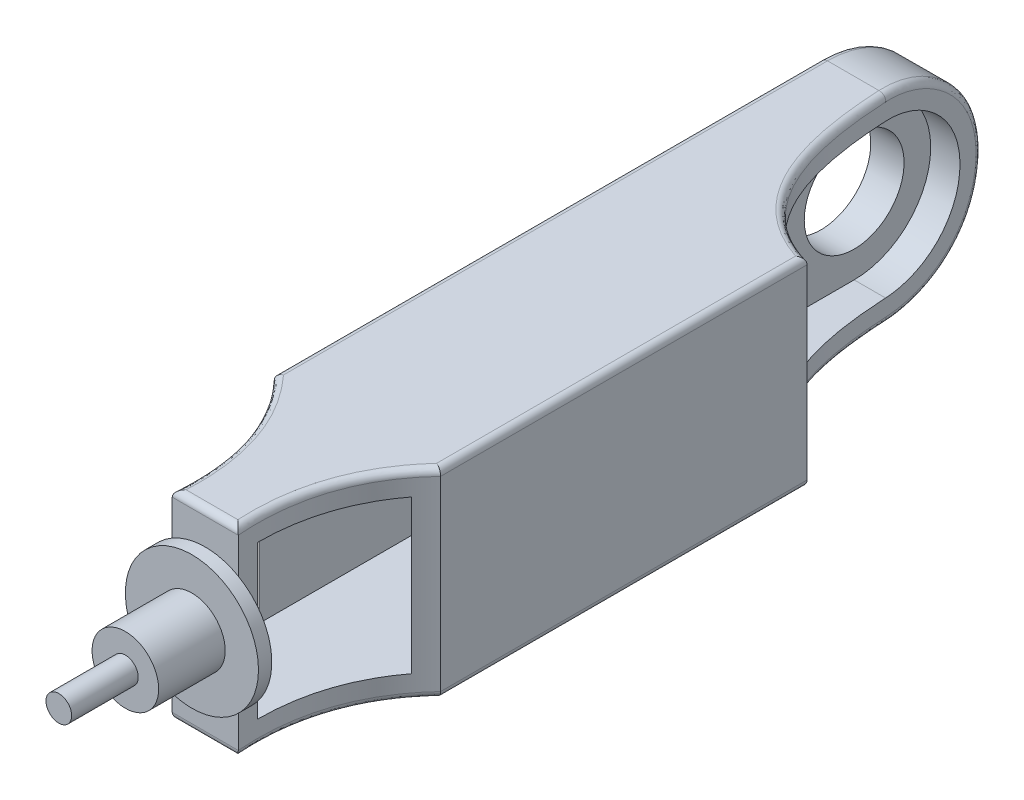
from build123d import *

# Parameters (mm, degrees)
SKETCH1_W           = 25
SKETCH1_H           = 30
BOSS_EXTRUDE1_DEPTH = 120
CUT_EXTRUDE1_REACH  = 125.491
CUT_EXTRUDE2_REACH  = 126.323
CUT_EXTRUDE3_DEPTH  = 20
CUT_EXTRUDE4_REACH  = 123.578
SKETCH5_W           = 18
SKETCH5_H           = 23
CUT_EXTRUDE5_REACH  = 125.491
SKETCH8_R           = 7.5
SKETCH10_W          = 25
SKETCH10_H          = 30
BOSS_EXTRUDE2_DEPTH = 3
SKETCH11_R          = 10
BOSS_EXTRUDE3_DEPTH = 2
SKETCH12_R          = 5
BOSS_EXTRUDE4_DEPTH = 10
SKETCH13_R          = 1.92997192
BOSS_EXTRUDE5_DEPTH = 10
CUT_EXTRUDE6_REACH  = 147.672
FILLET3_R           = 1


with BuildPart() as part:
    # Sketch1 → Boss-Extrude1 (new body)
    with BuildSketch(Plane.XY):
        Rectangle(SKETCH1_W, SKETCH1_H)
    extrude(amount=BOSS_EXTRUDE1_DEPTH)

    # Sketch2 → Cut-Extrude1 (cut, up to next)
    with BuildSketch(Plane(origin=(12.5, 0, 0), x_dir=(0, 0, -1), z_dir=(1, 0, 0)), mode=Mode.PRIVATE) as cut_extrude1_sk1:
        with BuildLine():
            ThreePointArc((0, 0), (-4.393398282, -10.606601718), (-15, -15))
            Line((-15, -15), (0, -15))
            Line((0, -15), (0, 0))
        make_face()
    cut_extrude1_tool1 = extrude(cut_extrude1_sk1.sketch, amount=-CUT_EXTRUDE1_REACH, mode=Mode.PRIVATE) & part.part
    # Sketch2 → Cut-Extrude1 (cut, up to next)
    with BuildSketch(Plane(origin=(12.5, 0, 0), x_dir=(0, 0, -1), z_dir=(1, 0, 0)), mode=Mode.PRIVATE) as cut_extrude1_sk2:
        with BuildLine():
            Line((0, 15), (-15, 15))
            ThreePointArc((-15, 15), (-4.393398282, 10.606601718), (0, 0))
            Line((0, 0), (0, 15))
        make_face()
    cut_extrude1_tool2 = extrude(cut_extrude1_sk2.sketch, amount=-CUT_EXTRUDE1_REACH, mode=Mode.PRIVATE) & part.part
    add(cut_extrude1_tool1.solids().sort_by_distance((12.5, -11.649481, 3.350519))[0], mode=Mode.SUBTRACT)
    add(cut_extrude1_tool2.solids().sort_by_distance((12.5, 11.649481, 3.350519))[0], mode=Mode.SUBTRACT)

    # Sketch3 → Cut-Extrude2 (cut, up to next)
    with BuildSketch(Plane.XZ.offset(15), mode=Mode.PRIVATE) as cut_extrude2_sk1:
        with BuildLine():
            Line((12.5, 42.064929479), (12.5, 0))
            Line((12.5, 0), (-3.454555728, 0))
            add(Edge.make_bspline(
                [(-3.454555728, 0), (-1.763470209, 8.714471378), (-6.787088449, 36.410313027), (12.5, 42.064929479)],
                knots=[0, 0, 0, 0, 1, 1, 1, 1], degree=3))
        make_face()
    cut_extrude2_tool1 = extrude(cut_extrude2_sk1.sketch, amount=-CUT_EXTRUDE2_REACH, mode=Mode.PRIVATE) & part.part
    add(cut_extrude2_tool1.solids().sort_by_distance((5.501655, -15, 18.266652))[0], mode=Mode.SUBTRACT)

    # Sketch4 → Cut-Extrude3 (cut)
    with BuildSketch(Plane(origin=(12.5, 0, 0), x_dir=(0, 0, -1), z_dir=(1, 0, 0))):
        with BuildLine():
            Line((-15, 11.5), (-42.064929479, 11.5))
            Line((-42.064929479, 11.5), (-42.064929479, -11.5))
            Line((-42.064929479, -11.5), (-15, -11.5))
            ThreePointArc((-15, -11.5), (-3.5, 0), (-15, 11.5))
        make_face()
    extrude(amount=-CUT_EXTRUDE3_DEPTH, mode=Mode.SUBTRACT)

    # Sketch5 → Cut-Extrude4 (cut, up to next)
    with BuildSketch(Plane.XY.offset(120), mode=Mode.PRIVATE) as cut_extrude4_sk1:
        with Locations((1.5, 0)):
            Rectangle(SKETCH5_W, SKETCH5_H)
    cut_extrude4_tool1 = extrude(cut_extrude4_sk1.sketch, amount=-CUT_EXTRUDE4_REACH, mode=Mode.PRIVATE) & part.part
    add(cut_extrude4_tool1.solids().sort_by_distance((1.5, 0, 120))[0], mode=Mode.SUBTRACT)

    # Sketch8 → Cut-Extrude5 (cut, up to next)
    with BuildSketch(Plane.ZY.offset(12.5), mode=Mode.PRIVATE) as cut_extrude5_sk1:
        with Locations((15, 0)):
            Circle(SKETCH8_R)
    cut_extrude5_tool1 = extrude(cut_extrude5_sk1.sketch, amount=-CUT_EXTRUDE5_REACH, mode=Mode.PRIVATE) & part.part
    add(cut_extrude5_tool1.solids().sort_by_distance((-12.5, 0, 15))[0], mode=Mode.SUBTRACT)

    # Sketch10 → Boss-Extrude2 (add)
    with BuildSketch(Plane.XY.offset(120)):
        Rectangle(SKETCH10_W, SKETCH10_H)
    extrude(amount=-BOSS_EXTRUDE2_DEPTH)

    # Sketch11 → Boss-Extrude3 (add)
    with BuildSketch(Plane.XY.offset(120)):
        Circle(SKETCH11_R)
    extrude(amount=BOSS_EXTRUDE3_DEPTH)

    # Sketch12 → Boss-Extrude4 (add)
    with BuildSketch(Plane.XY.offset(122)):
        Circle(SKETCH12_R)
    extrude(amount=BOSS_EXTRUDE4_DEPTH)

    # Sketch13 → Boss-Extrude5 (add)
    with BuildSketch(Plane.XY.offset(132)):
        Circle(SKETCH13_R)
    extrude(amount=BOSS_EXTRUDE5_DEPTH)

    # Sketch14 → Cut-Extrude6 (cut, up to next)
    with BuildSketch(Plane(origin=(0, -15, 0), x_dir=(-1, 0, 0), z_dir=(0, -1, 0)), mode=Mode.PRIVATE) as cut_extrude6_sk1:
        with BuildLine():
            Line((12.5, -97.12696662), (12.5, -120))
            Line((12.5, -120), (4.95981677, -120))
            add(Edge.make_bspline(
                [(12.5, -97.12696662), (3.863460556, -106.320157614), (4.95981677, -120)],
                knots=[0, 0, 0, 1, 1, 1], degree=2))
        make_face()
    cut_extrude6_tool1 = extrude(cut_extrude6_sk1.sketch, amount=-CUT_EXTRUDE6_REACH, mode=Mode.PRIVATE) & part.part
    # Sketch14 → Cut-Extrude6 (cut, up to next)
    with BuildSketch(Plane(origin=(0, -15, 0), x_dir=(-1, 0, 0), z_dir=(0, -1, 0)), mode=Mode.PRIVATE) as cut_extrude6_sk2:
        with BuildLine():
            Line((-12.5, -97.12696662), (-12.5, -120))
            Line((-12.5, -120), (-4.95981677, -120))
            add(Edge.make_bspline(
                [(-12.5, -97.12696662), (-3.863460556, -106.320157614), (-4.95981677, -120)],
                knots=[0, 0, 0, 1, 1, 1], degree=2))
        make_face()
    cut_extrude6_tool2 = extrude(cut_extrude6_sk2.sketch, amount=-CUT_EXTRUDE6_REACH, mode=Mode.PRIVATE) & part.part
    add(cut_extrude6_tool1.solids().sort_by_distance((-9.247598, -15, 110.963633))[0], mode=Mode.SUBTRACT)
    add(cut_extrude6_tool2.solids().sort_by_distance((9.247598, -15, 110.963633))[0], mode=Mode.SUBTRACT)

    # Fillet3
    fillet3_edges = [part.edges().sort_by_distance(p)[0] for p in [
        (0, 15, 120),
        (0, -15, 120),
        (-12.5, -15, 56.06348331),
        (12.5, -15, 69.595948049),
        (12.5, 15, 69.595948049),
        (-12.5, 15, 56.06348331),
        (-6.29668447, -15, 107.441820462),
        (-6.207441288, 15, 107.717454112),
        (6.29668447, -15, 107.441820462),
        (6.207441288, 15, 107.717454112),
        (-12.5, 0, 0),
        (-3.096966909, -9.69261516, 3.552152534),
        (0.460808306, -15, 31.265379818),
        (0.470485786, 15, 31.287022493),
    ]]
    fillet(fillet3_edges, radius=FILLET3_R - 0.0001)  # a hair under: the kernel refuses the full size


solid = part.part
